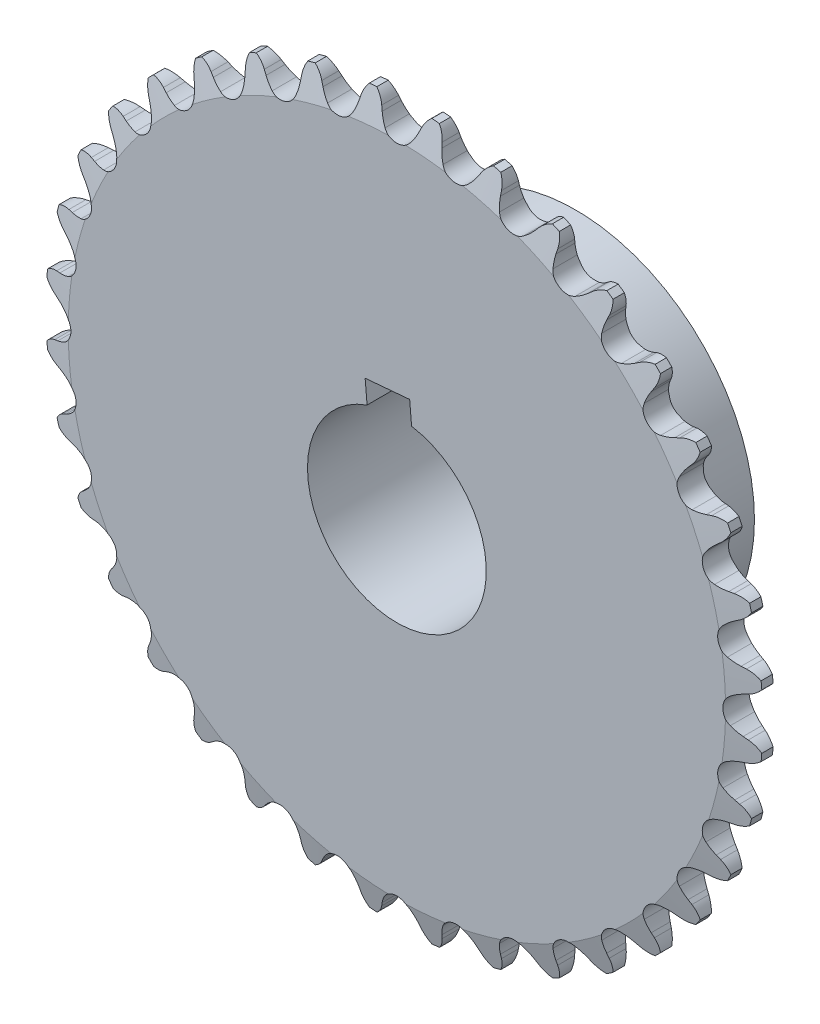
from build123d import *

# Parameters (mm, degrees)
TOOTH_CUT_NUMBER_OF_TEETH_36_DEPTH = 55.034537337
TOOTH_PATTERN_36_36_COUNT          = 36
SKETCH3_W                          = 16.256
SKETCH3_H                          = 19.05
SKETCH4_R                          = 9.525
CUT_EXTRUDE1_DEPTH                 = 58.127539121
CUT_EXTRUDE2_DEPTH                 = 58.127539121
SKETCH7_R                          = 2.38125
CUT_EXTRUDE3_DEPTH                 = 66.608034489
CUT_EXTRUDE3_TAPER                 = -1
EXTRUDE1_REACH                     = 67.608
EXTRUDE1_END_RADIUS                = 19.05
SKETCH8_R                          = 2.444778863
CUT_EXTRUDE4_START                 = -2.54
CUT_EXTRUDE4_DEPTH                 = 64.068034516
CIRPATTERN1_COUNT                  = 2
CIRPATTERN1_ANGLE                  = 90


with BuildPart() as part:
    # Sprocket-BaseSketch → 25 (04C) ANSI (ISO) Chain Number, 2.868in P.D. (revolve)
    with BuildSketch(Plane(origin=(0, 0, 0), x_dir=(0, 0, -1), z_dir=(1, 0, 0))):
        Polygon((1.397, 0), (1.397, 35.020416061), (0.60325, 38.195416061), (-0.60325, 38.195416061), (-1.397, 35.020416061), (-1.397, 0), align=None)
    revolve(axis=Axis((0, 0, -5.588), (0, 0, 1)))

    # Tooth-Sketch → Tooth-Cut, Number of teeth: 36 (cut, symmetric)
    with BuildSketch(Plane.XY):
        with BuildLine():
            Line((1.95260897, 36.506681097), (2.113680484, 36.943937247))
            ThreePointArc((2.113680484, 36.943937247), (3.086471, 38.204095605), (4.60520885, 38.681333297))
            ThreePointArc((4.60520885, 38.681333297), (0, 38.954505442), (-4.60520885, 38.681333297))
            ThreePointArc((-4.60520885, 38.681333297), (-3.086471, 38.204095605), (-2.113680484, 36.943937247))
            Line((-2.113680484, 36.943937247), (-1.95260897, 36.506681097))
            ThreePointArc((-1.95260897, 36.506681097), (-1.696264974, 35.939821607), (-1.361487812, 35.415449434))
            ThreePointArc((-1.361487812, 35.415449434), (0, 34.731684555), (1.361487812, 35.415449434))
            ThreePointArc((1.361487812, 35.415449434), (1.696264974, 35.939821607), (1.95260897, 36.506681097))
        make_face()
    tooth_cut_number_of_teeth_36 = extrude(amount=TOOTH_CUT_NUMBER_OF_TEETH_36_DEPTH, both=True, mode=Mode.SUBTRACT)

    # Tooth Pattern, 36 / 36: Tooth-Cut, Number of teeth: 36 ×36 about axis
    tooth_pattern_36_36_axis = Axis((0, 0, -88.99), (0, 0, 1))
    for i in range(1, TOOTH_PATTERN_36_36_COUNT):
        add(tooth_cut_number_of_teeth_36.rotate(tooth_pattern_36_36_axis, i * 360 / TOOTH_PATTERN_36_36_COUNT), mode=Mode.SUBTRACT)

    # Sketch3 → Hub-Revolve1 (revolve)
    with BuildSketch(Plane(origin=(0, 0, 0), x_dir=(0, 0, -1), z_dir=(1, 0, 0))):
        with Locations((9.525, 9.525)):
            Rectangle(SKETCH3_W, SKETCH3_H)
    revolve(axis=Axis((0, 0, 16.256), (0, 0, -1)))

    # Sketch4 → Cut-Extrude1 (cut, through all)
    with BuildSketch(Plane(origin=(0, 0, -17.653), x_dir=(-1, 0, 0), z_dir=(0, 0, -1))):
        Circle(SKETCH4_R)
    extrude(amount=-CUT_EXTRUDE1_DEPTH, mode=Mode.SUBTRACT)

    # Sketch6 → Cut-Extrude2 (cut, through all)
    with BuildSketch(Plane(origin=(0, 0, -17.653), x_dir=(-1, 0, 0), z_dir=(0, 0, -1))):
        Polygon((-1.568391162, 9.39498665), (-1.36085155, 11.767175275), (3.3835257, 11.35209605), (3.175986087, 8.979907426), align=None)
    extrude(amount=-CUT_EXTRUDE2_DEPTH, mode=Mode.SUBTRACT)

    # Sketch7 → Cut-Extrude3 (cut, through all)
    with BuildSketch(Plane(origin=(-1.011337075, 11.559635663, 0), x_dir=(0.9961946980917455, 0.08715574274765885, 0), z_dir=(0.08715574274765883, -0.9961946980917454, 0))):
        with Locations((0, -9.525)):
            Circle(SKETCH7_R)
    cut_extrude3 = extrude(amount=-CUT_EXTRUDE3_DEPTH, taper=CUT_EXTRUDE3_TAPER, mode=Mode.SUBTRACT)

    # Extrude1: up to this cylinder (the profile starts inside it)
    extrude1_end = Plane(origin=(0, 0, -9.525), z_dir=(0, 0, 1)) * Cylinder(EXTRUDE1_END_RADIUS, 174.316, mode=Mode.PRIVATE)
    # Sketch8 → Extrude1 (add, up to the surface)
    with BuildSketch(Plane(origin=(-1.011337075, 11.559635663, 0), x_dir=(0.9961946980917455, 0.08715574274765885, 0), z_dir=(0.08715574274765883, -0.9961946980917454, 0)), mode=Mode.PRIVATE) as extrude1_sk1:
        with Locations((0, -9.525)):
            Circle(SKETCH8_R)
    extrude1_tool1 = extrude(extrude1_sk1.sketch, amount=-EXTRUDE1_REACH, mode=Mode.PRIVATE) & extrude1_end
    extrude1 = extrude1_tool1.solids().sort_by_distance((-1.011337, 11.559636, -9.525))[0]
    add(extrude1)

    # Sketch9 → Cut-Extrude4 (cut, through all)
    with BuildSketch(Plane(origin=(-1.011337075, 11.559635663, 0), x_dir=(0.9961946980917455, 0.08715574274765885, 0), z_dir=(0.08715574274765883, -0.9961946980917454, 0)).offset(CUT_EXTRUDE4_START)):
        Polygon((0, -10.936493735), (1.222389431, -10.230746867), (1.222389431, -8.819253133), (0, -8.113506265), (-1.222389431, -8.819253133), (-1.222389431, -10.230746867), align=None)
    cut_extrude4 = extrude(amount=-CUT_EXTRUDE4_DEPTH, mode=Mode.SUBTRACT)

    # CirPattern1: Cut-Extrude3, Extrude1, Cut-Extrude4 ×2 about axis
    cirpattern1_axis = Axis((0, 0, 16.256), (0, 0, -1))
    add([cut_extrude3.rotate(cirpattern1_axis, i * CIRPATTERN1_ANGLE / (CIRPATTERN1_COUNT - 1)) for i in range(1, CIRPATTERN1_COUNT)], mode=Mode.SUBTRACT)
    add([extrude1.rotate(cirpattern1_axis, i * CIRPATTERN1_ANGLE / (CIRPATTERN1_COUNT - 1)) for i in range(1, CIRPATTERN1_COUNT)])
    add([cut_extrude4.rotate(cirpattern1_axis, i * CIRPATTERN1_ANGLE / (CIRPATTERN1_COUNT - 1)) for i in range(1, CIRPATTERN1_COUNT)], mode=Mode.SUBTRACT)


solid = part.part
